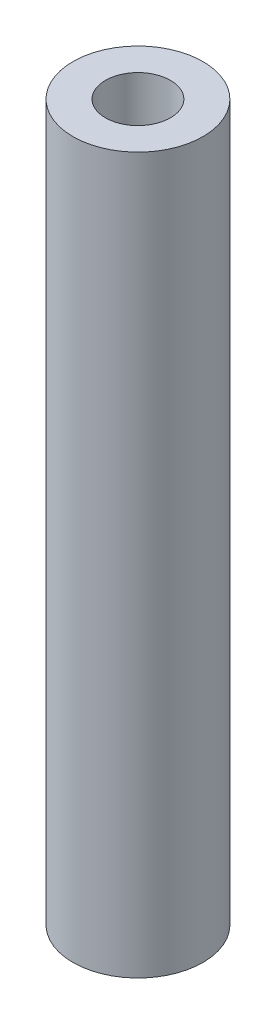
from build123d import *

# Parameters (mm, degrees)
SKETCH1_R             = 3
BOSS_EXTRUDE1_DEPTH   = 33
F_3_0MM_DOWEL_HOLE1_D = 3


with BuildPart() as part:
    # Sketch1 → Boss-Extrude1 (new body)
    with BuildSketch(Plane(origin=(0, 0, 0), x_dir=(1, 0, 0), z_dir=(0, 1, 0))):
        Circle(SKETCH1_R)
    extrude(amount=BOSS_EXTRUDE1_DEPTH)

    # Ø3.0mm Dowel Hole1 (through all)
    with Locations(Plane.ZX.offset(33)):
        with Locations((0, 0)):
            Hole(F_3_0MM_DOWEL_HOLE1_D / 2)


solid = part.part
